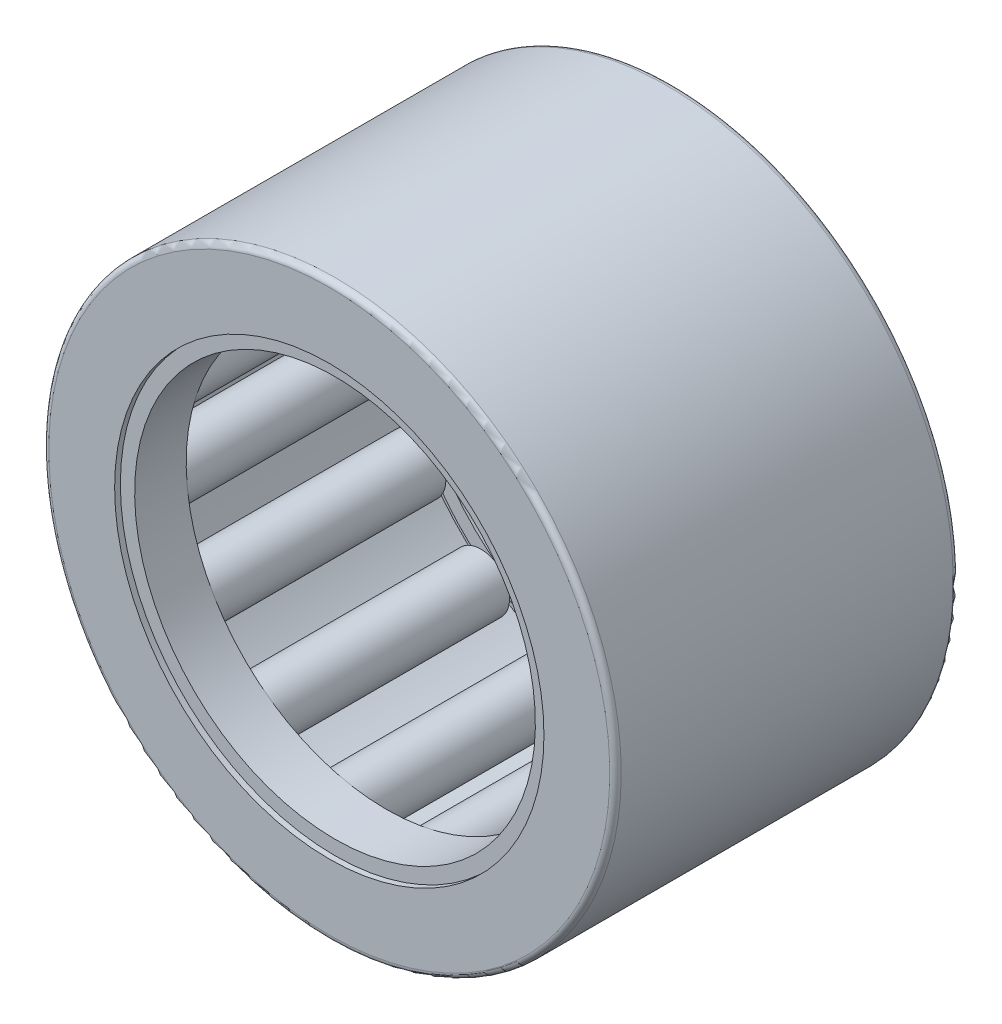
from build123d import *

# Parameters (mm, degrees)
SKETCH2_W         = 8
SKETCH2_H         = 0.75
SKETCH3_W         = 10
SKETCH3_H         = 0.25
CIRPATTERN1_COUNT = 15
CIRPATTERN1_ANGLE = 336
FILLET1_R         = 0.2
SKETCH4_W         = 1.8
SKETCH4_H         = 0.5
SKETCH5_W         = 1.8
SKETCH5_H         = 0.5


with BuildPart() as part:
    # Sketch7 → Revolve1 (revolve)
    with BuildSketch(Plane(origin=(0, 0, 0), x_dir=(0, 0, -1), z_dir=(1, 0, 0))):
        Polygon((-6, 10), (-6, 7.5), (-5, 7.5), (-5, 9), (5, 9), (5, 7.5), (6, 7.5), (6, 10), align=None)
    revolve(axis=Axis((0, 0, 6), (0, 0, -1)))

    # Fillet1
    fillet1_edges = [part.edges().sort_by_distance(p)[0] for p in [
        (0, -10, -6),
        (0, -10, 6),
    ]]
    fillet(fillet1_edges, radius=FILLET1_R)


with BuildPart() as body_2:
    # Sketch2 → Revolve2 (revolve)
    with BuildSketch(Plane(origin=(0, 0, 0), x_dir=(0, 0, -1), z_dir=(1, 0, 0))):
        with Locations((0, 8.625)):
            Rectangle(SKETCH2_W, SKETCH2_H)
    revolve(axis=Axis((0, 8, 4), (0, 0, -1)))


with BuildPart() as body_3:
    # Sketch3 → Revolve3 (revolve)
    with BuildSketch(Plane(origin=(0, 0, 0), x_dir=(0, 0, -1), z_dir=(1, 0, 0))):
        with Locations((0, 8.125)):
            Rectangle(SKETCH3_W, SKETCH3_H)
    revolve(axis=Axis((0, 8, 5), (0, 0, -1)))


with BuildPart() as cirpattern1_1:
    # CirPattern1: pattern copy
    add(body_2.part.rotate(Axis((0, 0, 6), (0, 0, -1)), 1 * CIRPATTERN1_ANGLE / (CIRPATTERN1_COUNT - 1)))


with BuildPart() as cirpattern1_2:
    # CirPattern1: pattern copy
    add(body_2.part.rotate(Axis((0, 0, 6), (0, 0, -1)), 2 * CIRPATTERN1_ANGLE / (CIRPATTERN1_COUNT - 1)))


with BuildPart() as cirpattern1_3:
    # CirPattern1: pattern copy
    add(body_2.part.rotate(Axis((0, 0, 6), (0, 0, -1)), 3 * CIRPATTERN1_ANGLE / (CIRPATTERN1_COUNT - 1)))


with BuildPart() as cirpattern1_4:
    # CirPattern1: pattern copy
    add(body_2.part.rotate(Axis((0, 0, 6), (0, 0, -1)), 4 * CIRPATTERN1_ANGLE / (CIRPATTERN1_COUNT - 1)))


with BuildPart() as cirpattern1_5:
    # CirPattern1: pattern copy
    add(body_2.part.rotate(Axis((0, 0, 6), (0, 0, -1)), 5 * CIRPATTERN1_ANGLE / (CIRPATTERN1_COUNT - 1)))


with BuildPart() as cirpattern1_6:
    # CirPattern1: pattern copy
    add(body_2.part.rotate(Axis((0, 0, 6), (0, 0, -1)), 6 * CIRPATTERN1_ANGLE / (CIRPATTERN1_COUNT - 1)))


with BuildPart() as cirpattern1_7:
    # CirPattern1: pattern copy
    add(body_2.part.rotate(Axis((0, 0, 6), (0, 0, -1)), 7 * CIRPATTERN1_ANGLE / (CIRPATTERN1_COUNT - 1)))


with BuildPart() as cirpattern1_8:
    # CirPattern1: pattern copy
    add(body_2.part.rotate(Axis((0, 0, 6), (0, 0, -1)), 8 * CIRPATTERN1_ANGLE / (CIRPATTERN1_COUNT - 1)))


with BuildPart() as cirpattern1_9:
    # CirPattern1: pattern copy
    add(body_2.part.rotate(Axis((0, 0, 6), (0, 0, -1)), 9 * CIRPATTERN1_ANGLE / (CIRPATTERN1_COUNT - 1)))


with BuildPart() as cirpattern1_10:
    # CirPattern1: pattern copy
    add(body_2.part.rotate(Axis((0, 0, 6), (0, 0, -1)), 10 * CIRPATTERN1_ANGLE / (CIRPATTERN1_COUNT - 1)))


with BuildPart() as cirpattern1_11:
    # CirPattern1: pattern copy
    add(body_2.part.rotate(Axis((0, 0, 6), (0, 0, -1)), 11 * CIRPATTERN1_ANGLE / (CIRPATTERN1_COUNT - 1)))


with BuildPart() as cirpattern1_12:
    # CirPattern1: pattern copy
    add(body_2.part.rotate(Axis((0, 0, 6), (0, 0, -1)), 12 * CIRPATTERN1_ANGLE / (CIRPATTERN1_COUNT - 1)))


with BuildPart() as cirpattern1_13:
    # CirPattern1: pattern copy
    add(body_2.part.rotate(Axis((0, 0, 6), (0, 0, -1)), 13 * CIRPATTERN1_ANGLE / (CIRPATTERN1_COUNT - 1)))


with BuildPart() as cirpattern1_14:
    # CirPattern1: pattern copy
    add(body_2.part.rotate(Axis((0, 0, 6), (0, 0, -1)), 14 * CIRPATTERN1_ANGLE / (CIRPATTERN1_COUNT - 1)))


with BuildPart() as cirpattern1_15:
    # CirPattern1: pattern copy
    add(body_3.part.rotate(Axis((0, 0, 6), (0, 0, -1)), 1 * CIRPATTERN1_ANGLE / (CIRPATTERN1_COUNT - 1)))


with BuildPart() as cirpattern1_16:
    # CirPattern1: pattern copy
    add(body_3.part.rotate(Axis((0, 0, 6), (0, 0, -1)), 2 * CIRPATTERN1_ANGLE / (CIRPATTERN1_COUNT - 1)))


with BuildPart() as cirpattern1_17:
    # CirPattern1: pattern copy
    add(body_3.part.rotate(Axis((0, 0, 6), (0, 0, -1)), 3 * CIRPATTERN1_ANGLE / (CIRPATTERN1_COUNT - 1)))


with BuildPart() as cirpattern1_18:
    # CirPattern1: pattern copy
    add(body_3.part.rotate(Axis((0, 0, 6), (0, 0, -1)), 4 * CIRPATTERN1_ANGLE / (CIRPATTERN1_COUNT - 1)))


with BuildPart() as cirpattern1_19:
    # CirPattern1: pattern copy
    add(body_3.part.rotate(Axis((0, 0, 6), (0, 0, -1)), 5 * CIRPATTERN1_ANGLE / (CIRPATTERN1_COUNT - 1)))


with BuildPart() as cirpattern1_20:
    # CirPattern1: pattern copy
    add(body_3.part.rotate(Axis((0, 0, 6), (0, 0, -1)), 6 * CIRPATTERN1_ANGLE / (CIRPATTERN1_COUNT - 1)))


with BuildPart() as cirpattern1_21:
    # CirPattern1: pattern copy
    add(body_3.part.rotate(Axis((0, 0, 6), (0, 0, -1)), 7 * CIRPATTERN1_ANGLE / (CIRPATTERN1_COUNT - 1)))


with BuildPart() as cirpattern1_22:
    # CirPattern1: pattern copy
    add(body_3.part.rotate(Axis((0, 0, 6), (0, 0, -1)), 8 * CIRPATTERN1_ANGLE / (CIRPATTERN1_COUNT - 1)))


with BuildPart() as cirpattern1_23:
    # CirPattern1: pattern copy
    add(body_3.part.rotate(Axis((0, 0, 6), (0, 0, -1)), 9 * CIRPATTERN1_ANGLE / (CIRPATTERN1_COUNT - 1)))


with BuildPart() as cirpattern1_24:
    # CirPattern1: pattern copy
    add(body_3.part.rotate(Axis((0, 0, 6), (0, 0, -1)), 10 * CIRPATTERN1_ANGLE / (CIRPATTERN1_COUNT - 1)))


with BuildPart() as cirpattern1_25:
    # CirPattern1: pattern copy
    add(body_3.part.rotate(Axis((0, 0, 6), (0, 0, -1)), 11 * CIRPATTERN1_ANGLE / (CIRPATTERN1_COUNT - 1)))


with BuildPart() as cirpattern1_26:
    # CirPattern1: pattern copy
    add(body_3.part.rotate(Axis((0, 0, 6), (0, 0, -1)), 12 * CIRPATTERN1_ANGLE / (CIRPATTERN1_COUNT - 1)))


with BuildPart() as cirpattern1_27:
    # CirPattern1: pattern copy
    add(body_3.part.rotate(Axis((0, 0, 6), (0, 0, -1)), 13 * CIRPATTERN1_ANGLE / (CIRPATTERN1_COUNT - 1)))


with BuildPart() as cirpattern1_28:
    # CirPattern1: pattern copy
    add(body_3.part.rotate(Axis((0, 0, 6), (0, 0, -1)), 14 * CIRPATTERN1_ANGLE / (CIRPATTERN1_COUNT - 1)))


with BuildPart() as body_32:
    # Sketch4 → Revolve4 (revolve)
    with BuildSketch(Plane(origin=(0, 0, 0), x_dir=(0, 0, -1), z_dir=(1, 0, 0))):
        with Locations((4.9, 7.25)):
            Rectangle(SKETCH4_W, SKETCH4_H)
    revolve(axis=Axis((0, 0, 6), (0, 0, -1)))


with BuildPart() as body_33:
    # Sketch5 → Revolve5 (revolve)
    with BuildSketch(Plane(origin=(0, 0, 0), x_dir=(0, 0, -1), z_dir=(1, 0, 0))):
        with Locations((-4.9, 7.25)):
            Rectangle(SKETCH5_W, SKETCH5_H)
    revolve(axis=Axis((0, 0, 6), (0, 0, -1)))


solid = Compound([part.part, body_2.part, body_3.part, cirpattern1_1.part, cirpattern1_2.part, cirpattern1_3.part, cirpattern1_4.part, cirpattern1_5.part, cirpattern1_6.part, cirpattern1_7.part, cirpattern1_8.part, cirpattern1_9.part, cirpattern1_10.part, cirpattern1_11.part, cirpattern1_12.part, cirpattern1_13.part, cirpattern1_14.part, cirpattern1_15.part, cirpattern1_16.part, cirpattern1_17.part, cirpattern1_18.part, cirpattern1_19.part, cirpattern1_20.part, cirpattern1_21.part, cirpattern1_22.part, cirpattern1_23.part, cirpattern1_24.part, cirpattern1_25.part, cirpattern1_26.part, cirpattern1_27.part, cirpattern1_28.part, body_32.part, body_33.part])
